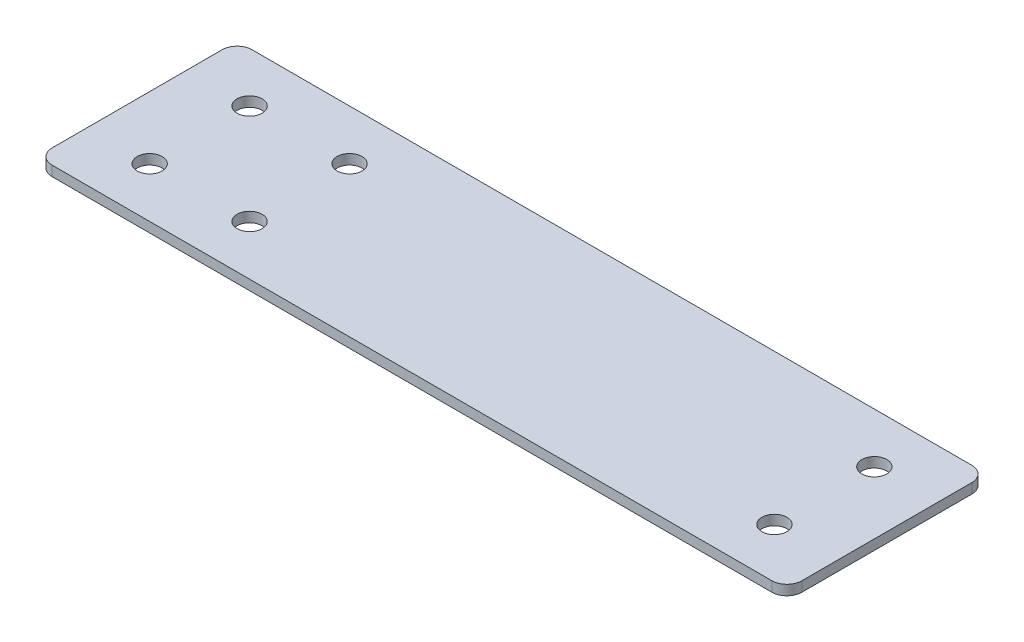
from build123d import *

# Parameters (mm, degrees)
BASE_FLANGE1_DEPTH    = 2
F_5_0MM_DOWEL_HOLE1_D = 5


# Sheet-metal steps are written as plain solids
with BuildPart() as part:
    # Sketch1 → Base-Flange1 (new body)
    with BuildSketch(Plane(origin=(0, 0, 0), x_dir=(1, 0, 0), z_dir=(0, 1, 0))):
        with BuildLine():
            Line((72, -20), (-72, -20))
            ThreePointArc((-72, -20), (-74.121320344, -19.121320344), (-75, -17))
            Line((-75, -17), (-75, 17))
            ThreePointArc((-75, 17), (-74.121320344, 19.121320344), (-72, 20))
            Line((-72, 20), (72, 20))
            ThreePointArc((72, 20), (74.121320344, 19.121320344), (75, 17))
            Line((75, 17), (75, -17))
            ThreePointArc((75, -17), (74.121320344, -19.121320344), (72, -20))
        make_face()
    extrude(amount=BASE_FLANGE1_DEPTH)

    # Ø5.0mm Dowel Hole1 (through all)
    with Locations(Plane(origin=(0, 2, 0), x_dir=(1, 0, 0), z_dir=(0, 1, 0))):
        with Locations((-62.5, 10), (-62.5, -10), (-42.5, -10), (-42.5, 10), (62.5, 10), (62.5, -10)):
            Hole(F_5_0MM_DOWEL_HOLE1_D / 2)


solid = part.part
